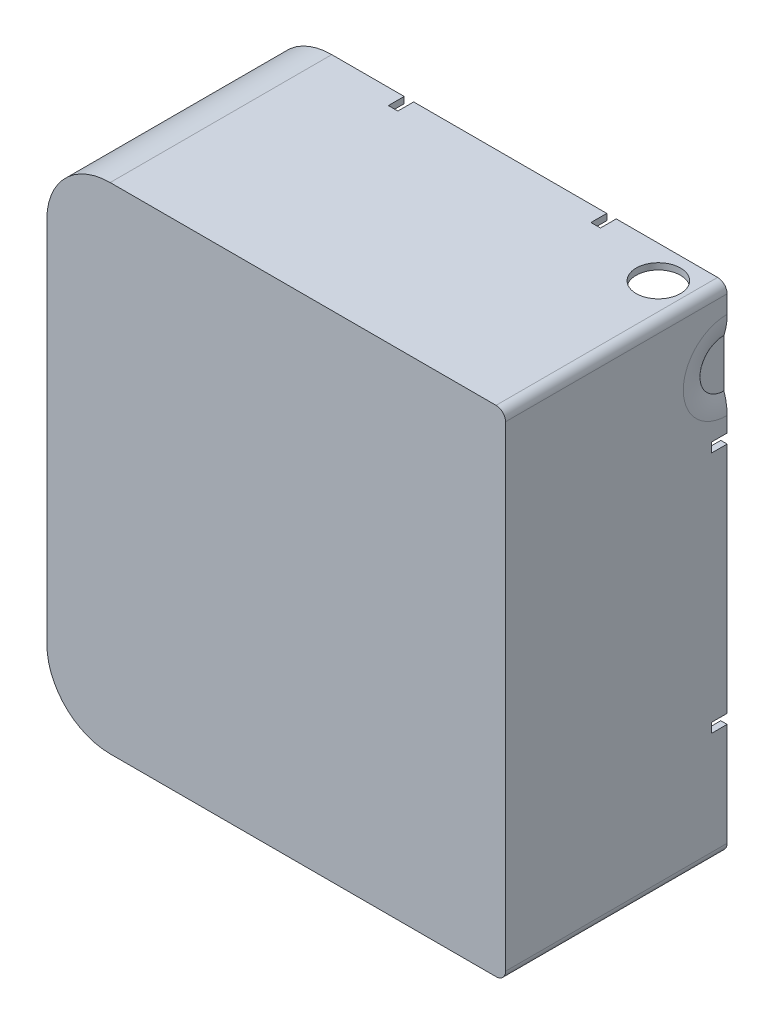
from build123d import *

# Parameters (mm, degrees)
ESQUISSE2_W              = 144.907881123
ESQUISSE2_H              = 156.330521118
BOSS_EXTRU_1_DEPTH       = 70
COQUE1_T                 = -2
ESQUISSE14_W             = 28.733729995
ESQUISSE14_H             = 101.576382864
BOSS_EXTRU_7_DEPTH       = 5.5
BOSS_EXTRU_7_TAPER       = 10
ENL_V_MAT_EXTRU_5_DEPTH  = 137.5
ESQUISSE16_R             = 3
ENL_V_MAT_EXTRU_6_DEPTH  = 3
ESQUISSE17_W             = 8
ESQUISSE17_H             = 24
BOSS_EXTRU_8_DEPTH       = 33
ESQUISSE18_W             = 12.041056231
ESQUISSE18_H             = 8.214509438
ENL_V_MAT_EXTRU_7_DEPTH  = 9
ESQUISSE19_R             = 0.8
ENL_V_MAT_EXTRU_8_DEPTH  = 5
ESQUISSE20_W             = 8.5
ESQUISSE20_H             = 24
BOSS_EXTRU_9_DEPTH       = 33
ESQUISSE22_W             = 11.894232579
ESQUISSE22_H             = 6.744261383
ENL_V_MAT_EXTRU_9_DEPTH  = 10
ESQUISSE25_W             = 8
ESQUISSE25_H             = 13.466046283
BOSS_EXTRU_10_DEPTH      = 30.549003
ESQUISSE26_W             = 8
ESQUISSE26_H             = 13.295181457
BOSS_EXTRU_11_DEPTH      = 30
ESQUISSE27_W             = 8.5
ESQUISSE27_H             = 13.691611871
BOSS_EXTRU_12_DEPTH      = 30
ESQUISSE28_W             = 8.5
ESQUISSE28_H             = 14.379576359
BOSS_EXTRU_14_DEPTH      = 29
ESQUISSE29_R             = 7
ENL_V_MAT_EXTRU_11_DEPTH = 5
ESQUISSE30_W             = 52.718186521
ESQUISSE30_H             = 13.817926224
ENL_V_MAT_EXTRU_12_DEPTH = 5
CONG_4_R                 = 20
CONG_5_R                 = 3
ENL_V_MAT_EXTRU_13_DEPTH = 1
CONG_6_R                 = 20
ESQUISSE21_R             = 0.8
ENL_V_MAT_EXTRU_14_DEPTH = 7
ESQUISSE34_W             = 2
ESQUISSE34_H             = 3
ESQUISSE34_W_2           = 3
ESQUISSE34_H_2           = 2
ENL_V_MAT_EXTRU_15_DEPTH = 5


with BuildPart() as part:
    # Esquisse2 → Boss.-Extru.1 (new body)
    with BuildSketch(Plane.XY):
        with Locations((-60.376721844, 72.874764276)):
            Rectangle(ESQUISSE2_W, ESQUISSE2_H)
    extrude(amount=BOSS_EXTRU_1_DEPTH)

    # Coque1
    coque1_openings = [part.faces().sort_by_distance(p)[0] for p in [
        (-60.376721844, 72.874764276, 0),
    ]]
    offset(amount=COQUE1_T, openings=coque1_openings, kind=Kind.INTERSECTION)

    # Esquisse14 → Boss.-Extru.7 (add)
    with BuildSketch(Plane.ZY.offset(132.830662405)):
        with Locations((49.34125564, 70.231172893)):
            Rectangle(ESQUISSE14_W, ESQUISSE14_H)
    extrude(amount=BOSS_EXTRU_7_DEPTH, taper=BOSS_EXTRU_7_TAPER)

    # Troue matien spirobs → Enlèv. mat.-Extru.5 (cut)
    # profile 1 of 2: a face of its own
    with BuildSketch(Plane(origin=(0, 0, 0), x_dir=(1, 0, 0), z_dir=(0, 1, 0))):
        Polygon((-132.851084635, -55.85540738), (-138.851094768, -52.391307109), (-138.851094768, -46.813956352), (-132.851084635, -43.34985608), align=None)
        Polygon((-133.351084635, -54.989382875), (-138.351094768, -52.102631674), (-138.351094768, -47.102631786), (-133.351084635, -44.215880585), align=None, mode=Mode.SUBTRACT)
    # profile 2 of 2: a face of its own
    with BuildSketch(Plane(origin=(0, 0, 0), x_dir=(1, 0, 0), z_dir=(0, 1, 0))):
        Polygon((-138.351094768, -52.102631674), (-138.351094768, -47.102631786), (-133.351084635, -44.215880585), (-133.351084635, -54.989382875), align=None)
    extrude(amount=ENL_V_MAT_EXTRU_5_DEPTH, mode=Mode.SUBTRACT)

    # Esquisse16 → Enlèv. mat.-Extru.6 (cut)
    with BuildSketch(Plane.ZY.offset(132.851084635)):
        with BuildLine():
            ThreePointArc((51.60263173, 94.988881377), (51.016845292, 96.403094939), (49.60263173, 96.988881377))
            Line((49.60263173, 96.988881377), (49.60263173, 92.988881377))
            ThreePointArc((49.60263173, 92.988881377), (51.016845292, 93.574667814), (51.60263173, 94.988881377))
        make_face()
        with BuildLine():
            Line((49.60263173, 92.988881377), (49.60263173, 96.988881377))
            ThreePointArc((49.60263173, 96.988881377), (47.60263173, 94.988881377), (49.60263173, 92.988881377))
        make_face()
        with BuildLine():
            ThreePointArc((51.60263173, 50.488881377), (51.016845292, 51.903094939), (49.60263173, 52.488881377))
            Line((49.60263173, 52.488881377), (49.60263173, 48.488881377))
            ThreePointArc((49.60263173, 48.488881377), (51.016845292, 49.074667814), (51.60263173, 50.488881377))
        make_face()
        with BuildLine():
            Line((49.60263173, 48.488881377), (49.60263173, 52.488881377))
            ThreePointArc((49.60263173, 52.488881377), (47.60263173, 50.488881377), (49.60263173, 48.488881377))
        make_face()
        with Locations((49.60263173, 72.738881377)):
            Circle(ESQUISSE16_R)
    extrude(amount=-ENL_V_MAT_EXTRU_6_DEPTH, mode=Mode.SUBTRACT)

    # Esquisse17 → Boss.-Extru.8 (add)
    with BuildSketch(Plane.XZ.offset(-149.040024835)):
        with Locations((-67.645104732, 27.450996733)):
            Rectangle(ESQUISSE17_W, ESQUISSE17_H)
        with Locations((-117.942168048, 27.160873918)):
            Rectangle(ESQUISSE17_W, ESQUISSE17_H)
    extrude(amount=BOSS_EXTRU_8_DEPTH)

    # Esquisse18 → Enlèv. mat.-Extru.7 (cut)
    with BuildSketch(Plane(origin=(-63.645104732, 0, 0), x_dir=(0, 0, -1), z_dir=(1, 0, 0))):
        with Locations((-28.237409826, 137.403900729)):
            Rectangle(ESQUISSE18_W, ESQUISSE18_H)
    extrude(amount=-ENL_V_MAT_EXTRU_7_DEPTH, mode=Mode.SUBTRACT)

    # Esquisse19 → Enlèv. mat.-Extru.8 (cut)
    with BuildSketch(Plane.XZ.offset(-116.040024835)):
        with Locations(Location((-68.110177619, 23.053024635, 0), (0, 0, 270))):
            Circle(ESQUISSE19_R)
        with Locations(Location((-68.110177619, 32.817579673, 0), (0, 0, 270))):
            Circle(ESQUISSE19_R)
        with Locations(Location((-117.542963794, 32.93870849, 0), (0, 0, 270))):
            Circle(ESQUISSE19_R)
        with Locations(Location((-117.542963794, 22.93870849, 0), (0, 0, 270))):
            Circle(ESQUISSE19_R)
    extrude(amount=-ENL_V_MAT_EXTRU_8_DEPTH, mode=Mode.SUBTRACT)

    # Esquisse20 → Boss.-Extru.9 (add)
    with BuildSketch(Plane(origin=(0, -3.290496283, 0), x_dir=(1, 0, 0), z_dir=(0, 1, 0))):
        with Locations((-117.838572927, -27.374102793)):
            Rectangle(ESQUISSE20_W, ESQUISSE20_H)
        with Locations((-67.264692574, -28.393869792)):
            Rectangle(ESQUISSE20_W, ESQUISSE20_H)
    extrude(amount=BOSS_EXTRU_9_DEPTH)

    # Esquisse22 → Enlèv. mat.-Extru.9 (cut)
    with BuildSketch(Plane(origin=(-63.014692574, 0, 0), x_dir=(0, 0, -1), z_dir=(1, 0, 0))):
        with Locations((-27.890614159, 7.930587585)):
            Rectangle(ESQUISSE22_W, ESQUISSE22_H)
    extrude(amount=-ENL_V_MAT_EXTRU_9_DEPTH, mode=Mode.SUBTRACT)

    # Esquisse25 → Boss.-Extru.10 (add)
    with BuildSketch(Plane.XY.offset(39.450996733)):
        with Locations((-67.645104732, 122.773047977)):
            Rectangle(ESQUISSE25_W, ESQUISSE25_H)
    extrude(amount=BOSS_EXTRU_10_DEPTH)

    # Esquisse26 → Boss.-Extru.11 (add)
    with BuildSketch(Plane.XY.offset(39.160873918)):
        with Locations((-117.942168048, 122.687615564)):
            Rectangle(ESQUISSE26_W, ESQUISSE26_H)
    extrude(amount=BOSS_EXTRU_11_DEPTH)

    # Esquisse27 → Boss.-Extru.12 (add)
    with BuildSketch(Plane.XY.offset(39.374102793)):
        with Locations((-117.838572927, 22.863697782)):
            Rectangle(ESQUISSE27_W, ESQUISSE27_H)
    extrude(amount=BOSS_EXTRU_12_DEPTH)

    # Esquisse28 → Boss.-Extru.14 (add)
    with BuildSketch(Plane.XY.offset(40.393869792)):
        with Locations((-67.264692574, 22.519715538)):
            Rectangle(ESQUISSE28_W, ESQUISSE28_H)
    extrude(amount=BOSS_EXTRU_14_DEPTH)

    # Esquisse29 → Enlèv. mat.-Extru.11 (cut)
    with BuildSketch(Plane(origin=(0, 151.040024835, 0), x_dir=(1, 0, 0), z_dir=(0, 1, 0))):
        with Locations(Location((0.637722391, -10.29069879, 0), (0, 0, 270))):
            Circle(ESQUISSE29_R)
    extrude(amount=-ENL_V_MAT_EXTRU_11_DEPTH, mode=Mode.SUBTRACT)

    # Esquisse30 → Enlèv. mat.-Extru.12 (cut)
    with BuildSketch(Plane.XZ.offset(5.290496283)):
        with Locations((-26.862211313, 13.280210157)):
            Rectangle(ESQUISSE30_W, ESQUISSE30_H)
    extrude(amount=-ENL_V_MAT_EXTRU_12_DEPTH, mode=Mode.SUBTRACT)

    # Congé4
    # the kernel refuses this fillet: 20 mm, written as the material it adds along each edge
    with BuildSketch(Plane(origin=(-130.830662405, 149.040024835, 0), x_dir=(1, 0, 0), z_dir=(0, 0, 1))) as cong_4_piece_1:
        with BuildLine():
            CenterArc((CONG_4_R, -CONG_4_R), CONG_4_R, 90, 90)
            Line((0, -CONG_4_R), (0, 0))
            Line((0, 0), (CONG_4_R, 0))
        make_face()
    extrude(amount=68)
    with BuildSketch(Plane(origin=(-130.830662405, -3.290496283, 68), x_dir=(0, 1, 0), z_dir=(0, 0, -1))) as cong_4_piece_2:
        with BuildLine():
            CenterArc((CONG_4_R, CONG_4_R), CONG_4_R, 180, 90)
            Line((0, CONG_4_R), (0, 0))
            Line((0, 0), (CONG_4_R, 0))
        make_face()
    extrude(amount=68)
    # the kernel refuses this fillet: 20 mm, written as the material it takes off along each edge
    with BuildSketch(Plane(origin=(-132.830662405, -5.290496283, -50), x_dir=(0, 1, 0), z_dir=(0, 0, 1)), Plane(origin=(-132.830662405, 151.040024835, -50), x_dir=(1, 0, 0), z_dir=(0, 0, 1))) as cong_4_2_piece_1:
        with BuildLine():
            CenterArc((CONG_4_R, -CONG_4_R), CONG_4_R, 90, 90)
            Line((0, -CONG_4_R), (0, 0))
            Line((0, 0), (CONG_4_R, 0))
        make_face()
    extrude(amount=170, mode=Mode.SUBTRACT)

    # Congé5
    cong_5_edges = [part.edges().sort_by_distance(p)[0] for p in [
        (12.077218718, -5.290496283, 35),
        (12.077218718, 151.040024835, 35),
    ]]
    fillet(cong_5_edges, radius=CONG_5_R)

    # Esquisse31 → Enlèv. mat.-Extru.13 (cut)
    with BuildSketch(Plane(origin=(12.077218718, 0, 0), x_dir=(0, 0, -1), z_dir=(1, 0, 0))):
        with BuildLine():
            Line((0, 120.991434469), (0, 136.191208624))
            ThreePointArc((0, 136.191208624), (-7.599887078, 128.591321546), (0, 120.991434469))
        make_face()
    extrude(amount=-ENL_V_MAT_EXTRU_13_DEPTH, mode=Mode.SUBTRACT)

    # Congé6
    # the kernel refuses this fillet: 20 mm, written as the material it takes off along each edge
    with BuildSketch(Plane(origin=(12.077218718, 128.591321546, 0), x_dir=(0, 0.003141587485881077, -0.9999950652018582), z_dir=(0, -0.9999950652018582, -0.003141587485881077))) as cong_6_piece_1:
        with BuildLine():
            CenterArc((13.844885076, -20), CONG_6_R, 90, 18.194872339)
            Line((7.599887078, -1), (7.474987118, -0.62))
            ThreePointArc((7.474987118, -0.62), (7.199887078, -0.5), (7.199887078, 0))
            Line((7.199887078, 0), (7.599887078, 0.4))
            Line((7.599887078, 0.4), (13.844885076, 0.4))
            Line((13.844885076, 0.4), (13.844885076, 0))
        make_face()
    revolve(axis=Axis((12.077218718, 128.591321546, 0), (1, 0, 0)), revolution_arc=359.64, mode=Mode.SUBTRACT)

    # Esquisse21 → Enlèv. mat.-Extru.14 (cut)
    with BuildSketch(Plane(origin=(0, 29.709503717, 0), x_dir=(1, 0, 0), z_dir=(0, 1, 0))):
        with Locations(Location((-68.061939997, -22.535603051, 0), (0, 0, 270))):
            Circle(ESQUISSE21_R)
        with Locations(Location((-68.061939997, -32.603026975, 0), (0, 0, 270))):
            Circle(ESQUISSE21_R)
        with Locations(Location((-117.577847279, -22.535603051, 0), (0, 0, 270))):
            Circle(ESQUISSE21_R)
        with Locations(Location((-117.561939997, -32.372185179, 0), (0, 0, 270))):
            Circle(ESQUISSE21_R)
    extrude(amount=-ENL_V_MAT_EXTRU_14_DEPTH, mode=Mode.SUBTRACT)

    # Esquisse34 → Enlèv. mat.-Extru.15 (cut)
    with BuildSketch(Plane(origin=(0, 0, 0), x_dir=(-1, 0, 0), z_dir=(0, 0, -1))):
        with Locations((131.830662405, 31.752830171)):
            Rectangle(ESQUISSE34_W, ESQUISSE34_H)
        with Locations((131.830662405, 108.450383814)):
            Rectangle(ESQUISSE34_W, ESQUISSE34_H)
        with Locations((-11.077218718, 31.752830171)):
            Rectangle(ESQUISSE34_W, ESQUISSE34_H)
        with Locations((-11.077218718, 108.450383814)):
            Rectangle(ESQUISSE34_W, ESQUISSE34_H)
        with Locations((88.44920315, 150.040024835)):
            Rectangle(ESQUISSE34_W_2, ESQUISSE34_H_2)
        with Locations((24.448737585, 150.040024835)):
            Rectangle(ESQUISSE34_W_2, ESQUISSE34_H_2)
        with Locations((24.448737585, -4.290496283)):
            Rectangle(ESQUISSE34_W_2, ESQUISSE34_H_2)
        with Locations((88.44920315, -4.290496283)):
            Rectangle(ESQUISSE34_W_2, ESQUISSE34_H_2)
    extrude(amount=-ENL_V_MAT_EXTRU_15_DEPTH, mode=Mode.SUBTRACT)


solid = part.part
